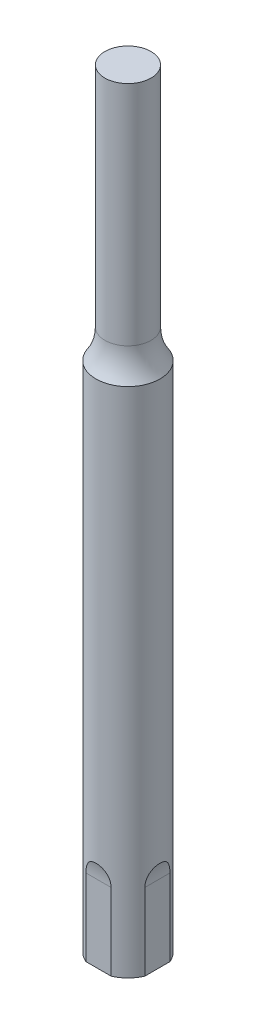
from build123d import *
from build123d.topology import SkipClean

# Parameters (mm, degrees)
SKETCH1_R           = 6.35
BOSS_EXTRUDE1_DEPTH = 25.4
SKETCH3_W           = 3.762901665
SKETCH3_H           = 11.173304621
SKETCH3_W_2         = 4.189249379
CUT_EXTRUDE2_DEPTH  = 25.4
CUT_EXTRUDE3_DEPTH  = 25.4
SKETCH5_R           = 6.35
BOSS_EXTRUDE2_DEPTH = 76.2
FILLET2_R           = 10.16
FILLET3_R           = 10.16
SKETCH6_R           = 4.572
BOSS_EXTRUDE3_DEPTH = 50.8
FILLET5_R           = 10.16


with BuildPart() as part:
    # Sketch1 → Boss-Extrude1 (new body)
    with BuildSketch(Plane(origin=(0, 0, 0), x_dir=(1, 0, 0), z_dir=(0, 1, 0))):
        with Locations(Location((0, 0, 0), (0, 0, 270))):
            Circle(SKETCH1_R)
    extrude(amount=BOSS_EXTRUDE1_DEPTH)

    # Sketch3 → Cut-Extrude2 (cut)
    with BuildSketch(Plane.XZ):
        with Locations((7.723450833, -0.009887881)):
            Rectangle(SKETCH3_W, SKETCH3_H)
        with Locations((-7.93662469, -0.009887881)):
            Rectangle(SKETCH3_W_2, SKETCH3_H)
    extrude(amount=-CUT_EXTRUDE2_DEPTH, mode=Mode.SUBTRACT)

    # Sketch4 → Cut-Extrude3 (cut)
    with BuildSketch(Plane.XZ):
        Polygon((5.523986446, -5.842), (-7.059783038, -5.842), (-7.059783038, -10.872351768), (5.523986446, -11.066959799), align=None)
    cut_extrude3 = extrude(amount=-CUT_EXTRUDE3_DEPTH, mode=Mode.SUBTRACT)

    # Sketch5 → Boss-Extrude2 (add)
    with BuildSketch(Plane(origin=(0, 25.4, 0), x_dir=(1, 0, 0), z_dir=(0, 1, 0))):
        with Locations(Location((0, 0, 0), (0, 0, 66.926081934))):
            Circle(SKETCH5_R)
    extrude(amount=BOSS_EXTRUDE2_DEPTH)

    # Fillet2
    # the kernel refuses this fillet: 10.16 mm, written as the material it adds along each edge
    with BuildSketch(Plane(origin=(-5.842, 25.4, 27.888681579), x_dir=(0, -1, 0), z_dir=(0, 0, -1))) as fillet2_piece_1_section:
        with BuildLine():
            CenterArc((FILLET2_R, FILLET2_R), FILLET2_R, 180, 90)
            Line((0, FILLET2_R), (0, 0))
            Line((0, 0), (FILLET2_R, 0))
        make_face()
    fillet2_piece_1 = extrude(amount=55.777363157, mode=Mode.PRIVATE)
    fillet2_piece_1 = fillet2_piece_1 & Plane(origin=(0, 21.230044771, 0), x_dir=(0, 0, 1), z_dir=(0, -1, 0)) * Cylinder(6.35, 153, mode=Mode.PRIVATE)
    add(fillet2_piece_1)
    with BuildSketch(Plane(origin=(5.842, 25.4, 27.888681579), x_dir=(0, -1, 0), z_dir=(0, 0, -1))) as fillet2_piece_2_section:
        with BuildLine():
            CenterArc((FILLET2_R, -FILLET2_R), FILLET2_R, 90, 90)
            Line((0, -FILLET2_R), (0, 0))
            Line((0, 0), (FILLET2_R, 0))
        make_face()
    fillet2_piece_2 = extrude(amount=55.777363157, mode=Mode.PRIVATE)
    fillet2_piece_2 = fillet2_piece_2 & Plane(origin=(0, 21.230044771, 0), x_dir=(0, 0, 1), z_dir=(0, -1, 0)) * Cylinder(6.35, 153, mode=Mode.PRIVATE)
    add(fillet2_piece_2)

    # Mirror1: Cut-Extrude3 across plane
    with SkipClean():  # the faces are left unmerged after this step: merging them gives an invalid solid
        add(cut_extrude3.mirror(Plane.XY), mode=Mode.SUBTRACT)
    add(part.part.scale(1), mode=Mode.REPLACE)  # the faces are merged on a copy

    # Fillet3
    # the kernel refuses this fillet: 10.16 mm, written as the material it adds along each edge
    with BuildSketch(Plane(origin=(27.888681579, 25.4, 5.842), x_dir=(0, -1, 0), z_dir=(-1, 0, 0))) as fillet3_piece_1_section:
        with BuildLine():
            CenterArc((FILLET3_R, FILLET3_R), FILLET3_R, 180, 90)
            Line((0, FILLET3_R), (0, 0))
            Line((0, 0), (FILLET3_R, 0))
        make_face()
    fillet3_piece_1 = extrude(amount=55.777363157, mode=Mode.PRIVATE)
    fillet3_piece_1 = fillet3_piece_1 & Plane(origin=(0, 21.230043926, 0), x_dir=(0, 0, 1), z_dir=(0, -1, 0)) * Cylinder(6.35, 153, mode=Mode.PRIVATE)
    add(fillet3_piece_1)
    with BuildSketch(Plane(origin=(27.888681579, 25.4, -5.842), x_dir=(0, 0, -1), z_dir=(-1, 0, 0))) as fillet3_piece_2_section:
        with BuildLine():
            CenterArc((FILLET3_R, FILLET3_R), FILLET3_R, 180, 90)
            Line((0, FILLET3_R), (0, 0))
            Line((0, 0), (FILLET3_R, 0))
        make_face()
    fillet3_piece_2 = extrude(amount=55.777363157, mode=Mode.PRIVATE)
    fillet3_piece_2 = fillet3_piece_2 & Plane(origin=(0, 21.230042518, 0), x_dir=(0, 0, 1), z_dir=(0, -1, 0)) * Cylinder(6.35, 153, mode=Mode.PRIVATE)
    add(fillet3_piece_2)

    # Sketch6 → Boss-Extrude3 (add)
    with BuildSketch(Plane(origin=(0, 101.6, 0), x_dir=(1, 0, 0), z_dir=(0, 1, 0))):
        with Locations(Location((0, 0, 0), (0, 0, 270))):
            Circle(SKETCH6_R)
    extrude(amount=BOSS_EXTRUDE3_DEPTH)

    # Fillet5
    # the kernel refuses this fillet: 10.16 mm, written as the material it adds along each edge
    with BuildSketch(Plane(origin=(0, 101.6, 0), x_dir=(0, 0, 1), z_dir=(-1, 0, 0))) as fillet5_piece_1:
        with BuildLine():
            CenterArc((14.732, 5.741748514), FILLET5_R, 180, 34.41150867)
            Line((4.572, 5.741748514), (4.3688, 5.741748514))
            Line((4.3688, 5.741748514), (4.3688, 0))
            Line((4.3688, 0), (4.572, -0.2032))
            ThreePointArc((4.572, -0.2032), (5.461, -0.2032), (6.18236, -0.11483497))
            Line((6.18236, -0.11483497), (6.35, 0))
        make_face()
    revolve(axis=Axis((0, 101.6, 0), (0, 1, 0)))


solid = part.part
